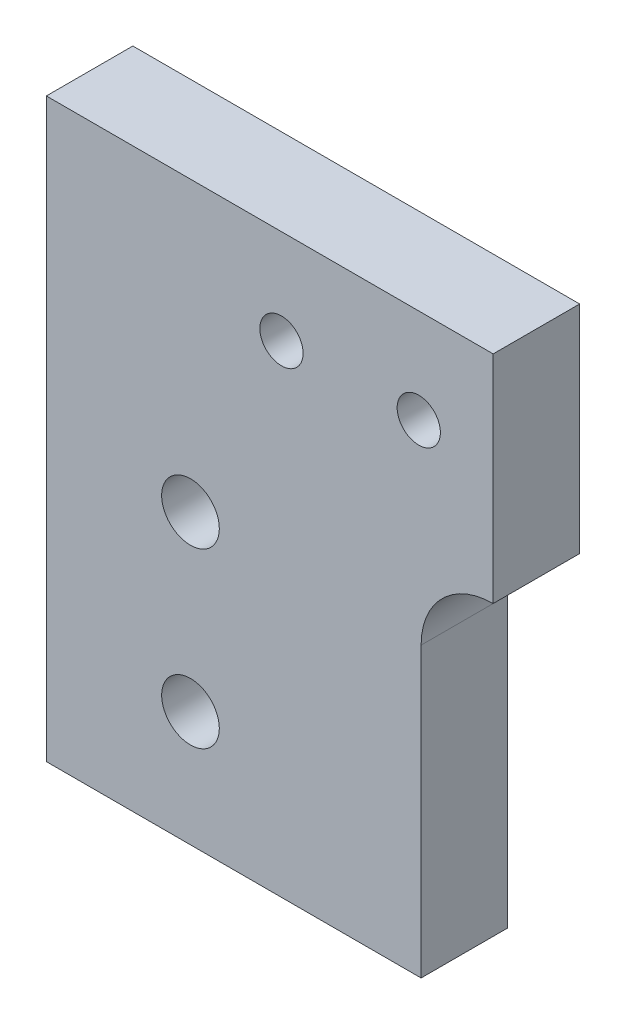
from build123d import *

# Parameters (mm, degrees)
ESBO_O1_W                = 31
ESBO_O1_H                = 40
RESSALTO_EXTRUS_O1_DEPTH = 6
ESBO_O2_R                = 2
ESBO_O2_W                = 5
ESBO_O2_H                = 25
CORTE_EXTRUS_O1_DEPTH    = 6
ESBO_O4_R                = 1.5
CORTE_EXTRUS_O2_DEPTH    = 6
ESBO_O5_R                = 2.5
CORTE_EXTRUS_O3_DEPTH    = 2.4
FILETE1_R                = 5


with BuildPart() as part:
    # Esboço1 → Ressalto-extrusão1 (new body)
    with BuildSketch(Plane.XY):
        Rectangle(ESBO_O1_W, ESBO_O1_H)
    extrude(amount=RESSALTO_EXTRUS_O1_DEPTH)

    # Esboço2 → Corte-extrusão1 (cut)
    with BuildSketch(Plane.XY.offset(6)):
        with Locations((-5.5, -12)):
            Circle(ESBO_O2_R)
        with Locations((-5.5, 0)):
            Circle(ESBO_O2_R)
        with Locations((13, -7.5)):
            Rectangle(ESBO_O2_W, ESBO_O2_H)
    extrude(amount=-CORTE_EXTRUS_O1_DEPTH, mode=Mode.SUBTRACT)

    # Esboço4 → Corte-extrusão2 (cut)
    with BuildSketch(Plane.XY.offset(6)):
        with Locations((0.8125, 13.4375)):
            Circle(ESBO_O4_R)
        with Locations((10.3375, 13.4375)):
            Circle(ESBO_O4_R)
    extrude(amount=-CORTE_EXTRUS_O2_DEPTH, mode=Mode.SUBTRACT)

    # Esboço5 → Corte-extrusão3 (cut)
    with BuildSketch(Plane(origin=(0, 0, 0), x_dir=(-1, 0, 0), z_dir=(0, 0, -1))):
        with Locations((-0.8125, 13.4375)):
            Circle(ESBO_O5_R)
        with Locations((-10.3375, 13.4375)):
            Circle(ESBO_O5_R)
    extrude(amount=-CORTE_EXTRUS_O3_DEPTH, mode=Mode.SUBTRACT)

    # Filete1
    filete1_edges = [part.edges().sort_by_distance(p)[0] for p in [
        (10.5, 5, 3),
    ]]
    fillet(filete1_edges, radius=FILETE1_R - 0.0001)  # a hair under: the kernel refuses the full size


solid = part.part
